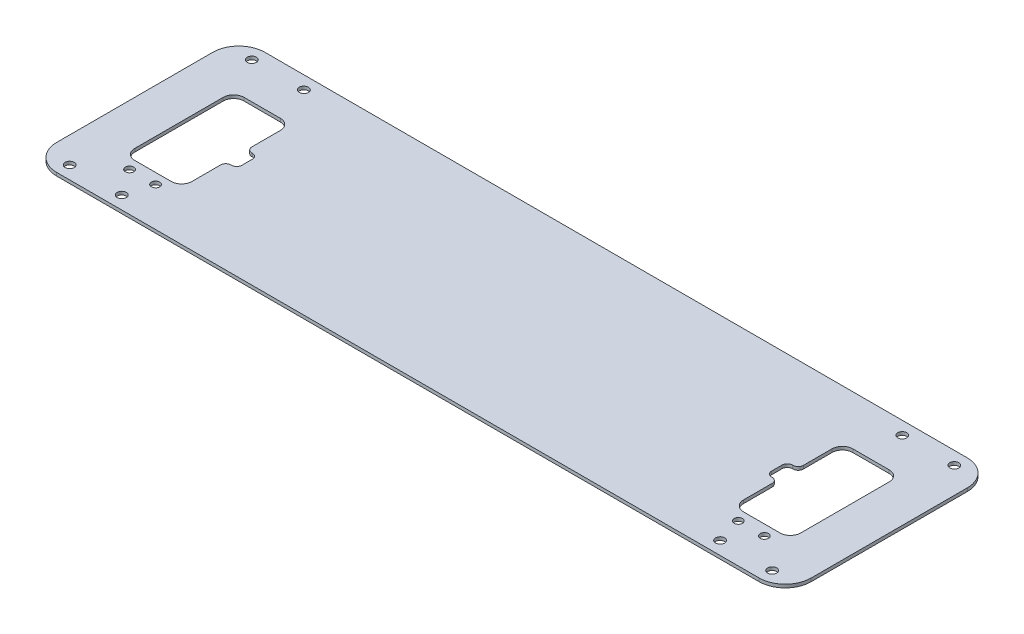
from build123d import *

# Parameters (mm, degrees)
SKETCH1_W           = 368.3
SKETCH1_H           = 101.6
SKETCH1_R           = 2.2225
SKETCH1_R_2         = 2.032
BOSS_EXTRUDE1_DEPTH = 1.5875
FILLET1_R           = 5.08
FILLET2_R           = 5.08
FILLET3_R           = 12.7
FILLET4_R           = 2.54


with BuildPart() as part:
    # Sketch1 → Boss-Extrude1 (new body)
    with BuildSketch(Plane(origin=(0, 0, 0), x_dir=(1, 0, 0), z_dir=(0, 1, 0))):
        Rectangle(SKETCH1_W, SKETCH1_H)
        with Locations((-171.45, -44.45)):
            Circle(SKETCH1_R, mode=Mode.SUBTRACT)
        with Locations((-146.05, -44.45)):
            Circle(SKETCH1_R, mode=Mode.SUBTRACT)
        with Locations((-154.94, -31.75)):
            Circle(SKETCH1_R_2, mode=Mode.SUBTRACT)
        with Locations((-142.24, -31.75)):
            Circle(SKETCH1_R_2, mode=Mode.SUBTRACT)
        Polygon((-134.62, -26.67), (-162.56, -26.67), (-162.56, 26.67), (-134.62, 26.67), (-134.62, 5.08), (-129.286, 5.08), (-129.286, -5.08), (-134.62, -5.08), align=None, mode=Mode.SUBTRACT)
        with Locations((146.05, -44.45)):
            Circle(SKETCH1_R, mode=Mode.SUBTRACT)
        with Locations((171.45, -44.45)):
            Circle(SKETCH1_R, mode=Mode.SUBTRACT)
        with Locations((142.24, -31.75)):
            Circle(SKETCH1_R_2, mode=Mode.SUBTRACT)
        with Locations((154.94, -31.75)):
            Circle(SKETCH1_R_2, mode=Mode.SUBTRACT)
        with Locations((-171.45, 44.45)):
            Circle(SKETCH1_R, mode=Mode.SUBTRACT)
        with Locations((-146.05, 44.45)):
            Circle(SKETCH1_R, mode=Mode.SUBTRACT)
        Polygon((134.62, 5.08), (134.62, 26.67), (162.56, 26.67), (162.56, -26.67), (134.62, -26.67), (134.62, -5.08), (129.286, -5.08), (129.286, 5.08), align=None, mode=Mode.SUBTRACT)
        with Locations((146.05, 44.45)):
            Circle(SKETCH1_R, mode=Mode.SUBTRACT)
        with Locations((171.45, 44.45)):
            Circle(SKETCH1_R, mode=Mode.SUBTRACT)
    extrude(amount=BOSS_EXTRUDE1_DEPTH)

    # Fillet1
    fillet1_edges = [part.edges().sort_by_distance(p)[0] for p in [
        (-134.62, 0.79375, 26.67),
        (-162.56, 0.79375, 26.67),
        (-162.56, 0.79375, -26.67),
        (-134.62, 0.79375, -26.67),
    ]]
    fillet(fillet1_edges, radius=FILLET1_R)

    # Fillet2
    fillet2_edges = [part.edges().sort_by_distance(p)[0] for p in [
        (162.56, 0.79375, 26.67),
        (134.62, 0.79375, 26.67),
        (134.62, 0.79375, -26.67),
        (162.56, 0.79375, -26.67),
    ]]
    fillet(fillet2_edges, radius=FILLET2_R)

    # Fillet3
    fillet3_edges = [part.edges().sort_by_distance(p)[0] for p in [
        (184.15, 0.79375, 50.8),
        (184.15, 0.79375, -50.8),
        (-184.15, 0.79375, 50.8),
        (-184.15, 0.79375, -50.8),
    ]]
    fillet(fillet3_edges, radius=FILLET3_R)

    # Fillet4
    fillet4_edges = [part.edges().sort_by_distance(p)[0] for p in [
        (-129.286, 0.79375, 5.08),
        (-129.286, 0.79375, -5.08),
        (129.286, 0.79375, 5.08),
        (129.286, 0.79375, -5.08),
        (134.62, 0.79375, 5.08),
        (134.62, 0.79375, -5.08),
        (-134.62, 0.79375, 5.08),
        (-134.62, 0.79375, -5.08),
    ]]
    fillet(fillet4_edges, radius=FILLET4_R)


solid = part.part
